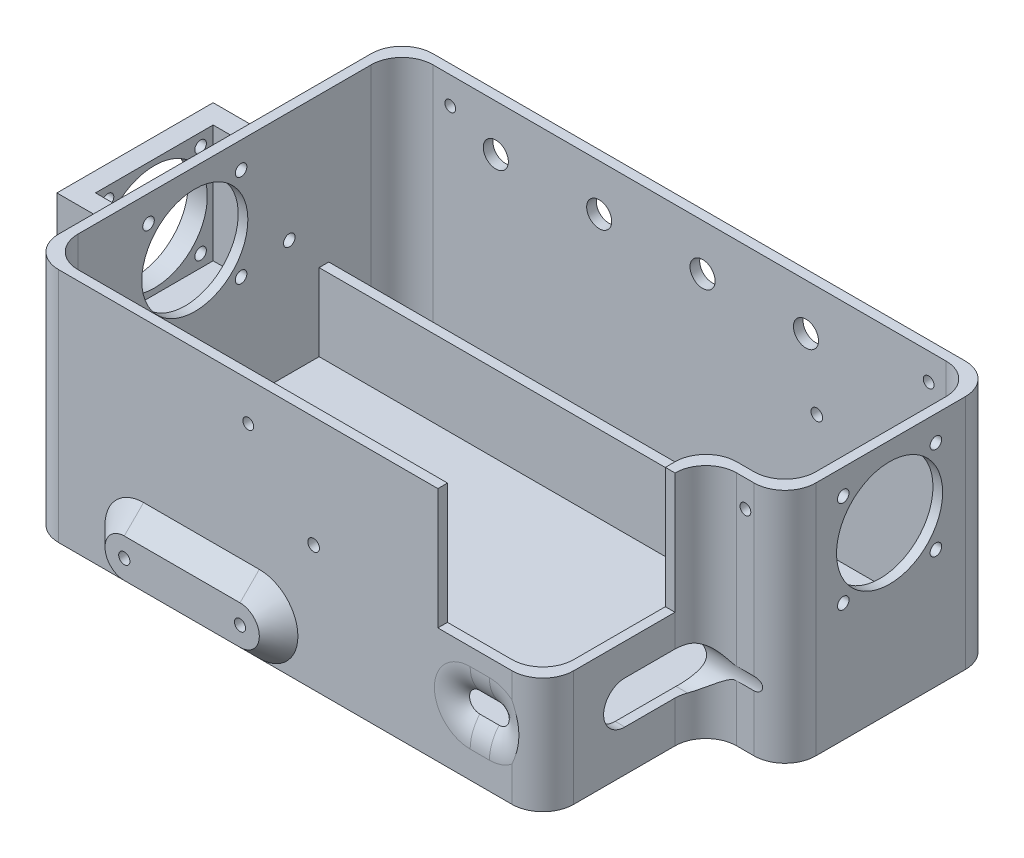
from build123d import *

# Parameters (mm, degrees)
SKETCH1_W                      = 149
SKETCH1_H                      = 92
BOSS_EXTRUDE1_DEPTH            = 2.5
BOSS_EXTRUDE2_START            = -2.5
SKETCH2_W                      = 154
SKETCH2_H                      = 97
SKETCH2_W_2                    = 149
SKETCH2_H_2                    = 92
BOSS_EXTRUDE2_DEPTH            = 61.28
SKETCH3_R                      = 3.25
CUT_EXTRUDE1_DEPTH             = 53.78
SKETCH5_W                      = 149
SKETCH5_H                      = 2.5
BOSS_EXTRUDE4_DEPTH            = 20
CUT_EXTRUDE2_REACH             = 174.695
SKETCH6_R                      = 1.5
SKETCH8_W                      = 2.5
SKETCH8_H                      = 39.75
BOSS_EXTRUDE5_DEPTH            = 27.5
SKETCH9_W                      = 20.5
SKETCH9_H                      = 42.25
CUT_EXTRUDE4_DEPTH             = 110.710931087
SKETCH10_W                     = 27.22
SKETCH10_H                     = 44.75
CUT_EXTRUDE5_DEPTH             = 31.28
SKETCH11_W                     = 40
SKETCH11_H                     = 2.5
CUT_EXTRUDE6_DEPTH             = 20
FILLET1_R                      = 8
CUT_EXTRUDE7_REACH             = 156.692
CUT_EXTRUDE7_DIRECTION_2_REACH = 156.692
CUT_EXTRUDE8_REACH             = 140.178
SKETCH13_R                     = 1.5
BOSS_EXTRUDE7_START            = 31.28
BOSS_EXTRUDE7_DEPTH            = 31.28
CUT_EXTRUDE9_REACH             = 140.178
FILLET2_R                      = 10
CUT_EXTRUDE10_REACH            = 140.178
SKETCH18_R                     = 1.5
CUT_EXTRUDE11_REACH            = 174.695
SKETCH19_R                     = 13.75
SKETCH19_R_2                   = 1.5
CUT_EXTRUDE12_REACH            = 174.695
SKETCH20_R                     = 13.75
SKETCH20_R_2                   = 1.5
BOSS_EXTRUDE8_DEPTH            = 13
SKETCH25_R                     = 1.45
BOSS_EXTRUDE10_DEPTH           = 5
CHAMFER4_SIZE                  = 5
CUT_EXTRUDE14_REACH            = 151.195
SKETCH26_R                     = 1.45
SKETCH27_R                     = 1.4
CUT_EXTRUDE15_DEPTH            = 10
SKETCH28_R                     = 1.4
CUT_EXTRUDE16_DEPTH            = 10
SKETCH29_R                     = 1.4
CUT_EXTRUDE17_DEPTH            = 10
SKETCH30_W                     = 40.5
SKETCH30_H                     = 35.5
SKETCH30_R                     = 1.5
SKETCH30_R_2                   = 13.75
BOSS_EXTRUDE11_DEPTH           = 5
CHAMFER5_SIZE                  = 13


# Some blends are built 0.0001 mm under size
with BuildPart() as part:
    # Sketch1 → Boss-Extrude1 (new body)
    with BuildSketch(Plane(origin=(0, 0, 0), x_dir=(1, 0, 0), z_dir=(0, 1, 0))):
        Rectangle(SKETCH1_W, SKETCH1_H)
    extrude(amount=BOSS_EXTRUDE1_DEPTH)

    # Sketch2 → Boss-Extrude2 (add)
    with BuildSketch(Plane(origin=(0, 2.5, 0), x_dir=(1, 0, 0), z_dir=(0, 1, 0)).offset(BOSS_EXTRUDE2_START)):
        Rectangle(SKETCH2_W, SKETCH2_H)
        Rectangle(SKETCH2_W_2, SKETCH2_H_2, mode=Mode.SUBTRACT)
    extrude(amount=BOSS_EXTRUDE2_DEPTH)

    # Sketch3 → Cut-Extrude1 (cut)
    with BuildSketch(Plane.XY):
        with Locations((-50.2, 49.28)):
            Circle(SKETCH3_R)
        with Locations((-23.4, 49.28)):
            Circle(SKETCH3_R)
        with Locations((3.4, 49.28)):
            Circle(SKETCH3_R)
        with Locations((30.2, 49.28)):
            Circle(SKETCH3_R)
    extrude(amount=-CUT_EXTRUDE1_DEPTH, mode=Mode.SUBTRACT)

    # Sketch5 → Boss-Extrude4 (add)
    with BuildSketch(Plane(origin=(0, 2.5, 0), x_dir=(1, 0, 0), z_dir=(0, 1, 0))):
        with Locations((0, 25.75)):
            Rectangle(SKETCH5_W, SKETCH5_H)
    extrude(amount=BOSS_EXTRUDE4_DEPTH)

    # Sketch6 → Cut-Extrude2 (cut, up to next)
    with BuildSketch(Plane.ZY.offset(77), mode=Mode.PRIVATE) as cut_extrude2_sk1:
        with Locations((32.22, 32.5)):
            Circle(SKETCH6_R)
    cut_extrude2_tool1 = extrude(cut_extrude2_sk1.sketch, amount=-CUT_EXTRUDE2_REACH, mode=Mode.PRIVATE) & part.part
    # Sketch6 → Cut-Extrude2 (cut, up to next)
    with BuildSketch(Plane.ZY.offset(77), mode=Mode.PRIVATE) as cut_extrude2_sk2:
        with Locations((-16.78, 32.5)):
            Circle(SKETCH6_R)
    cut_extrude2_tool2 = extrude(cut_extrude2_sk2.sketch, amount=-CUT_EXTRUDE2_REACH, mode=Mode.PRIVATE) & part.part
    add(cut_extrude2_tool1.solids().sort_by_distance((-77, 32.5, 32.22))[0], mode=Mode.SUBTRACT)
    add(cut_extrude2_tool2.solids().sort_by_distance((-77, 32.5, -16.78))[0], mode=Mode.SUBTRACT)

    # Sketch8 → Boss-Extrude5 (add)
    with BuildSketch(Plane(origin=(0, 2.5, 0), x_dir=(1, 0, 0), z_dir=(0, 1, 0))):
        with Locations((55.25, -26.125)):
            Rectangle(SKETCH8_W, SKETCH8_H)
        Polygon((54, -3.75), (54, -6.25), (56.5, -6.25), (74.5, -6.25), (74.5, -3.75), align=None)
    extrude(amount=BOSS_EXTRUDE5_DEPTH)

    # Sketch9 → Cut-Extrude4 (cut, through all)
    with BuildSketch(Plane(origin=(0, 61.28, 0), x_dir=(1, 0, 0), z_dir=(0, 1, 0))):
        with Locations((66.75, -27.375)):
            Rectangle(SKETCH9_W, SKETCH9_H)
    extrude(amount=-CUT_EXTRUDE4_DEPTH, mode=Mode.SUBTRACT)

    # Sketch10 → Cut-Extrude5 (cut)
    with BuildSketch(Plane(origin=(0, 61.28, 0), x_dir=(1, 0, 0), z_dir=(0, 1, 0))):
        with Locations((42.89, -26.125)):
            Rectangle(SKETCH10_W, SKETCH10_H)
    extrude(amount=-CUT_EXTRUDE5_DEPTH, mode=Mode.SUBTRACT)

    # Sketch11 → Cut-Extrude6 (cut)
    with BuildSketch(Plane(origin=(0, 22.5, 0), x_dir=(1, 0, 0), z_dir=(0, 1, 0))):
        with Locations((54.5, 25.75)):
            Rectangle(SKETCH11_W, SKETCH11_H)
    extrude(amount=-CUT_EXTRUDE6_DEPTH, mode=Mode.SUBTRACT)

    # Fillet1
    fillet1_edges = [part.edges().sort_by_distance(p)[0] for p in [
        (-74.5, 31.89, 46),
        (-77, 30.64, 48.5),
        (-74.5, 31.89, -46),
        (-77, 30.64, -48.5),
        (74.5, 31.89, -46),
        (77, 30.64, -48.5),
        (74.5, 16.25, 3.75),
        (77, 30.64, 6.25),
        (54, 16.25, 3.75),
        (56.5, 15, 6.25),
        (54, 16.25, 46),
        (56.5, 15, 48.5),
    ]]
    fillet(fillet1_edges, radius=FILLET1_R)

    # Sketch12 → Cut-Extrude7 (cut, up to next)
    with BuildSketch(Plane(origin=(56.5, 0, 0), x_dir=(0, 0, -1), z_dir=(1, 0, 0)), mode=Mode.PRIVATE) as cut_extrude7_sk1:
        with BuildLine():
            Line((-27.25, 21.75), (-11.5, 21.75))
            ThreePointArc((-11.5, 21.75), (-6, 16.25), (-11.5, 10.75))
            Line((-11.5, 10.75), (-27.25, 10.75))
            ThreePointArc((-27.25, 10.75), (-32.75, 16.25), (-27.25, 21.75))
        make_face()
    cut_extrude7_tool1 = extrude(cut_extrude7_sk1.sketch, amount=-CUT_EXTRUDE7_REACH, mode=Mode.PRIVATE) & part.part
    add(cut_extrude7_tool1.solids().sort_by_distance((56.5, 16.25, 19.375))[0], mode=Mode.SUBTRACT)

    # Sketch12 → Cut-Extrude7 direction 2 (cut, up to next)
    with BuildSketch(Plane(origin=(56.5, 0, 0), x_dir=(0, 0, -1), z_dir=(1, 0, 0)), mode=Mode.PRIVATE) as cut_extrude7_direction_2_sk1:
        with BuildLine():
            Line((-27.25, 21.75), (-11.5, 21.75))
            ThreePointArc((-11.5, 21.75), (-6, 16.25), (-11.5, 10.75))
            Line((-11.5, 10.75), (-27.25, 10.75))
            ThreePointArc((-27.25, 10.75), (-32.75, 16.25), (-27.25, 21.75))
        make_face()
    cut_extrude7_direction_2_tool1 = extrude(cut_extrude7_direction_2_sk1.sketch, amount=CUT_EXTRUDE7_DIRECTION_2_REACH, mode=Mode.PRIVATE) & part.part
    add(cut_extrude7_direction_2_tool1.solids().sort_by_distance((56.5, 16.25, 19.375))[0], mode=Mode.SUBTRACT)

    # Sketch13 → Cut-Extrude8 (cut, up to next)
    with BuildSketch(Plane.XY.offset(48.5), mode=Mode.PRIVATE) as cut_extrude8_sk1:
        with Locations((-2.92, 32.5)):
            Circle(SKETCH13_R)
    cut_extrude8_tool1 = extrude(cut_extrude8_sk1.sketch, amount=-CUT_EXTRUDE8_REACH, mode=Mode.PRIVATE) & part.part
    add(cut_extrude8_tool1.solids().sort_by_distance((-2.92, 32.5, 48.5))[0], mode=Mode.SUBTRACT)

    # Sketch15 → Boss-Extrude7 (add)
    with BuildSketch(Plane(origin=(0, 30, 0), x_dir=(1, 0, 0), z_dir=(0, 1, 0)).offset(BOSS_EXTRUDE7_START)):
        with BuildLine():
            Line((54, -14.25), (56.5, -14.25))
            ThreePointArc((56.5, -14.25), (58.843145751, -8.593145751), (64.5, -6.25))
            Line((64.5, -6.25), (69, -6.25))
            ThreePointArc((69, -6.25), (71.960084445, -5.6822204), (74.5, -4.059475019))
            Line((74.5, -4.059475019), (74.5, 4.25))
            ThreePointArc((74.5, 4.25), (72.156854249, -1.406854249), (66.5, -3.75))
            Line((66.5, -3.75), (62, -3.75))
            ThreePointArc((62, -3.75), (56.343145751, -6.093145751), (54, -11.75))
            Line((54, -11.75), (54, -14.25))
        make_face()
    extrude(amount=-BOSS_EXTRUDE7_DEPTH)

    # Sketch17 → Cut-Extrude9 (cut, up to next)
    with BuildSketch(Plane.XY.offset(48.5), mode=Mode.PRIVATE) as cut_extrude9_sk1:
        with BuildLine():
            Line((37.65, 18.9), (42.65, 18.9))
            ThreePointArc((42.65, 18.9), (45.3, 16.25), (42.65, 13.6))
            Line((42.65, 13.6), (37.65, 13.6))
            ThreePointArc((37.65, 13.6), (35, 16.25), (37.65, 18.9))
        make_face()
    cut_extrude9_tool1 = extrude(cut_extrude9_sk1.sketch, amount=-CUT_EXTRUDE9_REACH, mode=Mode.PRIVATE) & part.part
    add(cut_extrude9_tool1.solids().sort_by_distance((40.15, 16.25, 48.5))[0], mode=Mode.SUBTRACT)

    # Fillet2
    # the kernel refuses this fillet: 10 mm, written as the material it takes off along each edge
    with BuildSketch(Plane(origin=(37.65, 18.9, 48.5), x_dir=(0, 1, 0), z_dir=(1, 0, 0)), Plane(origin=(42.65, 13.6, 48.5), x_dir=(0, -1, 0), z_dir=(-1, 0, 0))) as fillet2_piece_1:
        with BuildLine():
            CenterArc((6.614378278, -10), FILLET2_R, 90, 41.409622109)
            Line((0, -2.5), (-0.132287566, -2.35))
            ThreePointArc((-0.132287566, -2.35), (-0.2, -1.25), (-0.2, 0))
            Line((-0.2, 0), (0, 0.2))
            Line((0, 0.2), (6.614378278, 0.2))
            Line((6.614378278, 0.2), (6.614378278, 0))
        make_face()
    extrude(amount=5, mode=Mode.SUBTRACT)
    with BuildSketch(Plane(origin=(42.65, 16.25, 48.5), x_dir=(0, 1, 0), z_dir=(-1, 0, 0))) as fillet2_piece_2:
        with BuildLine():
            CenterArc((9.264378278, 10), FILLET2_R, 228.590377891, 41.409622109)
            Line((2.65, 2.5), (2.517712434, 2.35))
            ThreePointArc((2.517712434, 2.35), (2.45, 1.25), (2.45, 0))
            Line((2.45, 0), (2.65, -0.2))
            Line((2.65, -0.2), (9.264378278, -0.2))
            Line((9.264378278, -0.2), (9.264378278, 0))
        make_face()
    revolve(axis=Axis((42.65, 16.25, 48.5), (0, 0, -1)), revolution_arc=180, mode=Mode.SUBTRACT)
    with BuildSketch(Plane(origin=(37.65, 16.25, 48.5), x_dir=(0, -1, 0), z_dir=(1, 0, 0))) as fillet2_piece_3:
        with BuildLine():
            CenterArc((9.264378278, 10), FILLET2_R, 228.590377891, 41.409622109)
            Line((2.65, 2.5), (2.517712434, 2.35))
            ThreePointArc((2.517712434, 2.35), (2.45, 1.25), (2.45, 0))
            Line((2.45, 0), (2.65, -0.2))
            Line((2.65, -0.2), (9.264378278, -0.2))
            Line((9.264378278, -0.2), (9.264378278, 0))
        make_face()
    revolve(axis=Axis((37.65, 16.25, 48.5), (0, 0, -1)), revolution_arc=180, mode=Mode.SUBTRACT)

    # Sketch18 → Cut-Extrude10 (cut, up to next)
    with BuildSketch(Plane(origin=(0, 0, -48.5), x_dir=(-1, 0, 0), z_dir=(0, 0, -1)), mode=Mode.PRIVATE) as cut_extrude10_sk1:
        with Locations((-33, 32.5)):
            Circle(SKETCH18_R)
    cut_extrude10_tool1 = extrude(cut_extrude10_sk1.sketch, amount=-CUT_EXTRUDE10_REACH, mode=Mode.PRIVATE) & part.part
    add(cut_extrude10_tool1.solids().sort_by_distance((33, 32.5, -48.5))[0], mode=Mode.SUBTRACT)

    # Sketch19 → Cut-Extrude11 (cut, up to next)
    with BuildSketch(Plane.ZY.offset(77), mode=Mode.PRIVATE) as cut_extrude11_sk1:
        with Locations((7.72, 42.5)):
            Circle(SKETCH19_R)
    cut_extrude11_tool1 = extrude(cut_extrude11_sk1.sketch, amount=-CUT_EXTRUDE11_REACH, mode=Mode.PRIVATE) & part.part
    # Sketch19 → Cut-Extrude11 (cut, up to next)
    with BuildSketch(Plane.ZY.offset(77), mode=Mode.PRIVATE) as cut_extrude11_sk2:
        with Locations((-4.28, 54.5)):
            Circle(SKETCH19_R_2)
    cut_extrude11_tool2 = extrude(cut_extrude11_sk2.sketch, amount=-CUT_EXTRUDE11_REACH, mode=Mode.PRIVATE) & part.part
    # Sketch19 → Cut-Extrude11 (cut, up to next)
    with BuildSketch(Plane.ZY.offset(77), mode=Mode.PRIVATE) as cut_extrude11_sk3:
        with Locations((19.72, 54.5)):
            Circle(SKETCH19_R_2)
    cut_extrude11_tool3 = extrude(cut_extrude11_sk3.sketch, amount=-CUT_EXTRUDE11_REACH, mode=Mode.PRIVATE) & part.part
    # Sketch19 → Cut-Extrude11 (cut, up to next)
    with BuildSketch(Plane.ZY.offset(77), mode=Mode.PRIVATE) as cut_extrude11_sk4:
        with Locations((19.72, 30.5)):
            Circle(SKETCH19_R_2)
    cut_extrude11_tool4 = extrude(cut_extrude11_sk4.sketch, amount=-CUT_EXTRUDE11_REACH, mode=Mode.PRIVATE) & part.part
    # Sketch19 → Cut-Extrude11 (cut, up to next)
    with BuildSketch(Plane.ZY.offset(77), mode=Mode.PRIVATE) as cut_extrude11_sk5:
        with Locations((-4.28, 30.5)):
            Circle(SKETCH19_R_2)
    cut_extrude11_tool5 = extrude(cut_extrude11_sk5.sketch, amount=-CUT_EXTRUDE11_REACH, mode=Mode.PRIVATE) & part.part
    add(cut_extrude11_tool1.solids().sort_by_distance((-77, 42.5, 7.72))[0], mode=Mode.SUBTRACT)
    add(cut_extrude11_tool2.solids().sort_by_distance((-77, 54.5, -4.28))[0], mode=Mode.SUBTRACT)
    add(cut_extrude11_tool3.solids().sort_by_distance((-77, 54.5, 19.72))[0], mode=Mode.SUBTRACT)
    add(cut_extrude11_tool4.solids().sort_by_distance((-77, 30.5, 19.72))[0], mode=Mode.SUBTRACT)
    add(cut_extrude11_tool5.solids().sort_by_distance((-77, 30.5, -4.28))[0], mode=Mode.SUBTRACT)

    # Sketch20 → Cut-Extrude12 (cut, up to next)
    with BuildSketch(Plane(origin=(77, 0, 0), x_dir=(0, 0, -1), z_dir=(1, 0, 0)), mode=Mode.PRIVATE) as cut_extrude12_sk1:
        with Locations((20.875, 42.75)):
            Circle(SKETCH20_R)
    cut_extrude12_tool1 = extrude(cut_extrude12_sk1.sketch, amount=-CUT_EXTRUDE12_REACH, mode=Mode.PRIVATE) & part.part
    # Sketch20 → Cut-Extrude12 (cut, up to next)
    with BuildSketch(Plane(origin=(77, 0, 0), x_dir=(0, 0, -1), z_dir=(1, 0, 0)), mode=Mode.PRIVATE) as cut_extrude12_sk2:
        with Locations((8.875, 54.75)):
            Circle(SKETCH20_R_2)
    cut_extrude12_tool2 = extrude(cut_extrude12_sk2.sketch, amount=-CUT_EXTRUDE12_REACH, mode=Mode.PRIVATE) & part.part
    # Sketch20 → Cut-Extrude12 (cut, up to next)
    with BuildSketch(Plane(origin=(77, 0, 0), x_dir=(0, 0, -1), z_dir=(1, 0, 0)), mode=Mode.PRIVATE) as cut_extrude12_sk3:
        with Locations((32.875, 54.75)):
            Circle(SKETCH20_R_2)
    cut_extrude12_tool3 = extrude(cut_extrude12_sk3.sketch, amount=-CUT_EXTRUDE12_REACH, mode=Mode.PRIVATE) & part.part
    # Sketch20 → Cut-Extrude12 (cut, up to next)
    with BuildSketch(Plane(origin=(77, 0, 0), x_dir=(0, 0, -1), z_dir=(1, 0, 0)), mode=Mode.PRIVATE) as cut_extrude12_sk4:
        with Locations((32.875, 30.75)):
            Circle(SKETCH20_R_2)
    cut_extrude12_tool4 = extrude(cut_extrude12_sk4.sketch, amount=-CUT_EXTRUDE12_REACH, mode=Mode.PRIVATE) & part.part
    # Sketch20 → Cut-Extrude12 (cut, up to next)
    with BuildSketch(Plane(origin=(77, 0, 0), x_dir=(0, 0, -1), z_dir=(1, 0, 0)), mode=Mode.PRIVATE) as cut_extrude12_sk5:
        with Locations((8.875, 30.75)):
            Circle(SKETCH20_R_2)
    cut_extrude12_tool5 = extrude(cut_extrude12_sk5.sketch, amount=-CUT_EXTRUDE12_REACH, mode=Mode.PRIVATE) & part.part
    add(cut_extrude12_tool1.solids().sort_by_distance((77, 42.75, -20.875))[0], mode=Mode.SUBTRACT)
    add(cut_extrude12_tool2.solids().sort_by_distance((77, 54.75, -8.875))[0], mode=Mode.SUBTRACT)
    add(cut_extrude12_tool3.solids().sort_by_distance((77, 54.75, -32.875))[0], mode=Mode.SUBTRACT)
    add(cut_extrude12_tool4.solids().sort_by_distance((77, 30.75, -32.875))[0], mode=Mode.SUBTRACT)
    add(cut_extrude12_tool5.solids().sort_by_distance((77, 30.75, -8.875))[0], mode=Mode.SUBTRACT)

    # Sketch22 → Boss-Extrude8 (add)
    with BuildSketch(Plane.ZY.offset(77)):
        Polygon((-12.53, 57.75), (-12.53, 22.25), (27.97, 22.25), (27.97, 57.75), (22.97, 57.75), (22.97, 27.25), (-7.53, 27.25), (-7.53, 57.75), align=None)
    extrude(amount=BOSS_EXTRUDE8_DEPTH)

    # Sketch25 → Boss-Extrude10 (add)
    with BuildSketch(Plane.XY.offset(48.5)):
        with BuildLine():
            Line((-47, 15), (-17, 15))
            ThreePointArc((-17, 15), (-12, 10), (-17, 5))
            Line((-17, 5), (-47, 5))
            ThreePointArc((-47, 5), (-52, 10), (-47, 15))
        make_face()
        with Locations((-47, 10)):
            Circle(SKETCH25_R, mode=Mode.SUBTRACT)
        with Locations((-17, 10)):
            Circle(SKETCH25_R, mode=Mode.SUBTRACT)
    extrude(amount=BOSS_EXTRUDE10_DEPTH)

    # Chamfer4
    chamfer4_edges = [part.edges().sort_by_distance(p)[0] for p in [
        (-32, 15, 48.5),
        (-52, 10, 48.5),
        (-12, 10, 48.5),
        (-32, 5, 48.5),
    ]]
    chamfer(chamfer4_edges, length=CHAMFER4_SIZE - 0.0001)  # a hair under: the kernel refuses the full size

    # Sketch26 → Cut-Extrude14 (cut, up to next)
    with BuildSketch(Plane.XY.offset(53.5), mode=Mode.PRIVATE) as cut_extrude14_sk1:
        with Locations(Location((-17, 10, 0), (0, 0, 180))):
            Circle(SKETCH26_R)
    cut_extrude14_tool1 = extrude(cut_extrude14_sk1.sketch, amount=-CUT_EXTRUDE14_REACH, mode=Mode.PRIVATE) & part.part
    # Sketch26 → Cut-Extrude14 (cut, up to next)
    with BuildSketch(Plane.XY.offset(53.5), mode=Mode.PRIVATE) as cut_extrude14_sk2:
        with Locations(Location((-47, 10, 0), (0, 0, 180))):
            Circle(SKETCH26_R)
    cut_extrude14_tool2 = extrude(cut_extrude14_sk2.sketch, amount=-CUT_EXTRUDE14_REACH, mode=Mode.PRIVATE) & part.part
    add(cut_extrude14_tool1.solids().sort_by_distance((-17, 10, 53.5))[0], mode=Mode.SUBTRACT)
    add(cut_extrude14_tool2.solids().sort_by_distance((-47, 10, 53.5))[0], mode=Mode.SUBTRACT)

    # Sketch27 → Cut-Extrude15 (cut)
    with BuildSketch(Plane.XY.offset(6.25)):
        with Locations((66.75, 54.28)):
            Circle(SKETCH27_R)
    extrude(amount=-CUT_EXTRUDE15_DEPTH, mode=Mode.SUBTRACT)

    # Sketch28 → Cut-Extrude16 (cut)
    with BuildSketch(Plane(origin=(0, 0, -48.5), x_dir=(-1, 0, 0), z_dir=(0, 0, -1))):
        with Locations((-62, 54.28)):
            Circle(SKETCH28_R)
        with Locations((62, 54.28)):
            Circle(SKETCH28_R)
    extrude(amount=-CUT_EXTRUDE16_DEPTH, mode=Mode.SUBTRACT)

    # Sketch29 → Cut-Extrude17 (cut)
    with BuildSketch(Plane.XY.offset(48.5)):
        with Locations((-19.86, 51.28)):
            Circle(SKETCH29_R)
    extrude(amount=-CUT_EXTRUDE17_DEPTH, mode=Mode.SUBTRACT)

    # Sketch30 → Boss-Extrude11 (add)
    with BuildSketch(Plane.ZY.offset(90)):
        with Locations((7.72, 40)):
            Rectangle(SKETCH30_W, SKETCH30_H)
        with Locations((-4.28, 30.5)):
            Circle(SKETCH30_R, mode=Mode.SUBTRACT)
        with Locations((19.72, 30.5)):
            Circle(SKETCH30_R, mode=Mode.SUBTRACT)
        with Locations((19.72, 54.5)):
            Circle(SKETCH30_R, mode=Mode.SUBTRACT)
        with Locations((-4.28, 54.5)):
            Circle(SKETCH30_R, mode=Mode.SUBTRACT)
        with Locations((7.72, 42.5)):
            Circle(SKETCH30_R_2, mode=Mode.SUBTRACT)
    extrude(amount=-BOSS_EXTRUDE11_DEPTH)

    # Chamfer5
    chamfer5_edges = [part.edges().sort_by_distance(p)[0] for p in [
        (-77, 22.25, 7.72),
    ]]
    chamfer(chamfer5_edges, length=CHAMFER5_SIZE - 0.0001)  # a hair under: the kernel refuses the full size


solid = part.part
